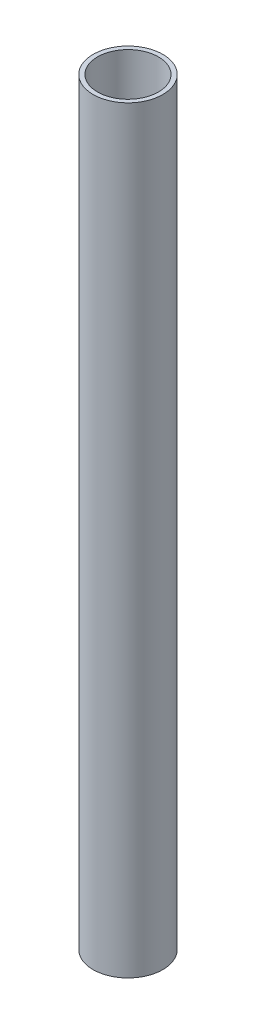
from build123d import *

# Parameters (mm, degrees)
SKETCH1_R           = 8
SKETCH1_R_2         = 7
BOSS_EXTRUDE1_DEPTH = 174.1


with BuildPart() as part:
    # Sketch1 → Boss-Extrude1 (new body)
    with BuildSketch(Plane(origin=(0, 0, 0), x_dir=(1, 0, 0), z_dir=(0, 1, 0))):
        Circle(SKETCH1_R)
        Circle(SKETCH1_R_2, mode=Mode.SUBTRACT)
    extrude(amount=BOSS_EXTRUDE1_DEPTH)


solid = part.part
